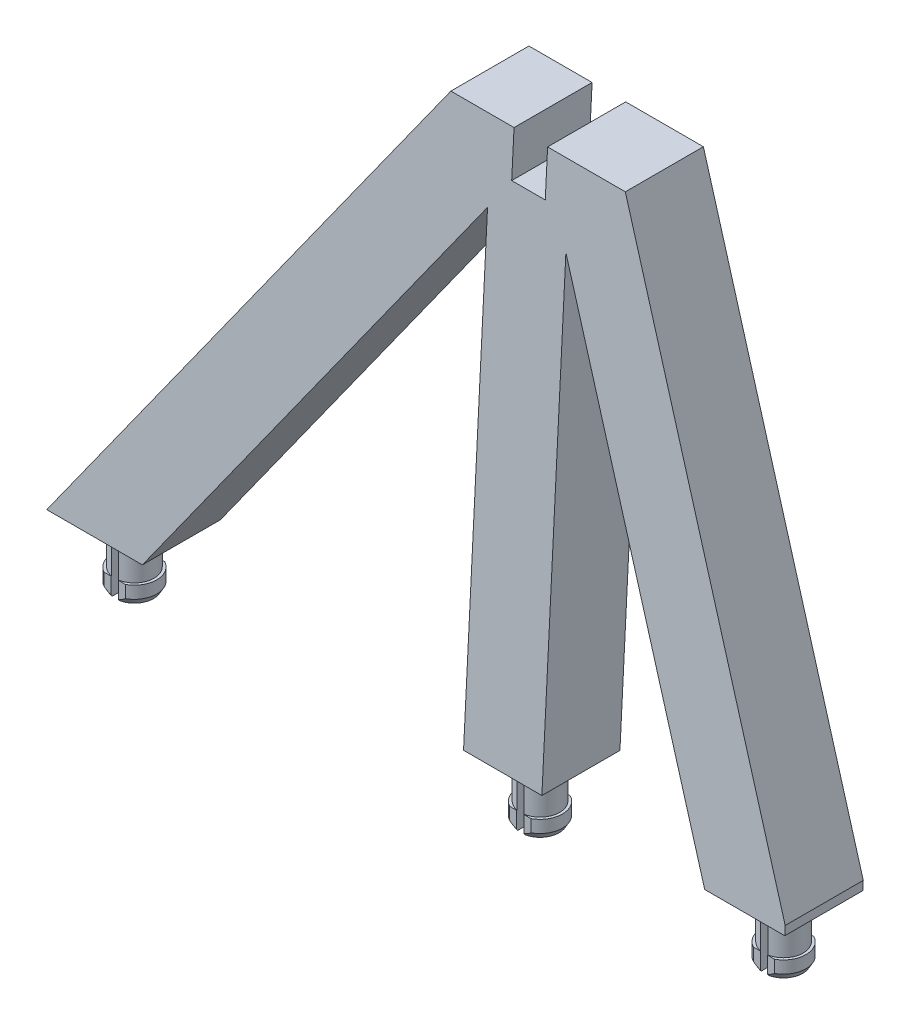
from build123d import *
from OCP.BRepFilletAPI import BRepFilletAPI_MakeChamfer

# Parameters (mm, degrees)
BOSS_EXTRUDE2_DEPTH     = 11.0744
CUT_EXTRUDE1_DEPTH      = 158.120213562
CUT_EXTRUDE1_DEPTH_BACK = 158.120213562
SKETCH3_W               = 4.7625
SKETCH3_H               = 6.35
CUT_EXTRUDE6_DEPTH      = 158.120213562
CUT_EXTRUDE6_DEPTH_BACK = 158.120213562
SKETCH12_W              = 1.27
SKETCH12_H              = 1.27
SKETCH12_W_2            = 12.7
SKETCH12_H_2            = 12.7
SKETCH13_R              = 2.794
BOSS_EXTRUDE3_DEPTH     = 6.35
SKETCH14_R              = 3.175
BOSS_EXTRUDE4_DEPTH     = 2.54
CUT_EXTRUDE7_REACH      = 163.613
SKETCH15_W              = 1.016
SKETCH15_H              = 6.35
SKETCH15_W_2            = 3.01608289
SKETCH15_H_2            = 0.381
SKETCH17_R              = 3.96875
BOSS_EXTRUDE5_DEPTH     = 16.44396
SKETCH18_R              = 2.38125
CUT_EXTRUDE9_DEPTH      = 5.334
CHAMFER1_SIZE           = 0.79375
CHAMFER1_SIZE2          = 0.458271776
SKETCH19_W              = 6.0325
SKETCH19_H              = 64.754314085
BOSS_EXTRUDE11_DEPTH    = 8.542621607


with BuildPart() as part:
    # Sketch2 → Boss-Extrude2 (new, along a direction that is not the sketch's normal)
    with BuildSketch(Plane(origin=(0, -0.301230094, -5.747812595), x_dir=(1, 0, 0), z_dir=(0, 0.05233595624294042, 0.998629534754574))):
        Polygon((-31.991936044, 0.301643486), (-59.03245329, 76.501643486), (-83.778875482, 76.501643486), (-137.117219796, 0.301643486), (-123.552823331, 0.301643486), (-77.992987563, 65.389143486), (-77.992987563, 0.301643486), (-66.880487563, 0.301643486), (-66.880487563, 65.389143486), (-43.783379083, 0.301643486), align=None)
    extrude(amount=BOSS_EXTRUDE2_DEPTH, dir=(0, 0, 1))

    # Sketch3 → Cut-Extrude1 (cut, two sides: drawn at the far end of the back side and taken through both)
    with BuildSketch(Plane.XY.offset(-CUT_EXTRUDE1_DEPTH_BACK)):
        with Locations((-72.436737563, 72.920570548)):
            Rectangle(SKETCH3_W, SKETCH3_H)
    extrude(amount=CUT_EXTRUDE1_DEPTH + CUT_EXTRUDE1_DEPTH_BACK, mode=Mode.SUBTRACT)

    # Sketch12 → Cut-Extrude6 (cut, two sides: drawn at the far end of the back side and taken through both)
    with BuildSketch(Plane.XY.offset(-CUT_EXTRUDE6_DEPTH_BACK)):
        with Locations((-31.794579083, 0.635)):
            Rectangle(SKETCH12_W, SKETCH12_H)
        with Locations((-144.340183331, 6.35)):
            Rectangle(SKETCH12_W_2, SKETCH12_H_2)
    extrude(amount=CUT_EXTRUDE6_DEPTH + CUT_EXTRUDE6_DEPTH_BACK, mode=Mode.SUBTRACT)

    # Shell13: read off the stored shape, not the designer's step
    # Shell13: loft between two sections, ruled curve by curve
    shell13_from = [
        Edge.make_line((-67.225707879, 73.555570548, -9.618483502), (-41.990365712, 2.54, -5.896715155)),
        Edge.make_line((-35.590124494, 2.54, -5.896715155), (-60.82546666, 73.555570548, -9.618483502)),
        Edge.make_line((-41.990365712, 2.54, -5.896715155), (-35.590124494, 2.54, -5.896715155)),
        Edge.make_line((-60.82546666, 73.555570548, -9.618483502), (-67.225707879, 73.555570548, -9.618483502)),
    ]
    shell13_to = [
        Edge.make_line((-67.225707879, 73.555570548, -1.087569261), (-41.990365712, 2.54, 2.634199086)),
        Edge.make_line((-35.590124494, 2.54, 2.634199086), (-60.82546666, 73.555570548, -1.087569261)),
        Edge.make_line((-41.990365712, 2.54, 2.634199086), (-35.590124494, 2.54, 2.634199086)),
        Edge.make_line((-60.82546666, 73.555570548, -1.087569261), (-67.225707879, 73.555570548, -1.087569261)),
    ]
    shell13 = Solid(Shell([*[Face.make_surface_from_curves(shell13_from[k], shell13_to[k]) for k in range(4)], Face(Wire(shell13_from)), Face(Wire(shell13_to))]))
    add(shell13, mode=Mode.SUBTRACT)

    # Shell13 2: loft between two sections, ruled curve by curve
    shell13_2_from = [
        Edge.make_line((-75.452987563, 2.54, -5.896715155), (-69.420487563, 2.54, -5.896715155)),
        Edge.make_line((-75.452987563, 67.205570548, -9.285694103), (-69.420487563, 67.205570548, -9.285694103)),
        Edge.make_line((-69.420487563, 2.54, -5.896715155), (-69.420487563, 67.205570548, -9.285694103)),
        Edge.make_line((-75.452987563, 67.205570548, -9.285694103), (-75.452987563, 2.54, -5.896715155)),
    ]
    shell13_2_to = [
        Edge.make_line((-75.452987563, 2.54, 2.634199086), (-69.420487563, 2.54, 2.634199086)),
        Edge.make_line((-75.452987563, 67.205570548, -0.754779862), (-69.420487563, 67.205570548, -0.754779862)),
        Edge.make_line((-69.420487563, 2.54, 2.634199086), (-69.420487563, 67.205570548, -0.754779862)),
        Edge.make_line((-75.452987563, 67.205570548, -0.754779862), (-75.452987563, 2.54, 2.634199086)),
    ]
    shell13_2 = Solid(Shell([*[Face.make_surface_from_curves(shell13_2_from[k], shell13_2_to[k]) for k in range(4)], Face(Wire(shell13_2_from)), Face(Wire(shell13_2_to))]))
    add(shell13_2, mode=Mode.SUBTRACT)

    # Shell13 3: loft between two sections, ruled curve by curve
    shell13_3_from = [
        Edge.make_line((-132.235001715, 2.54, -5.896715155), (-124.87427188, 2.54, -5.896715155)),
        Edge.make_line((-82.457426933, 73.555570548, -9.618483502), (-77.357987563, 73.555570548, -9.618483502)),
        Edge.make_line((-82.457426933, 73.555570548, -9.618483502), (-132.235001715, 2.54, -5.896715155)),
        Edge.make_line((-124.87427188, 2.54, -5.896715155), (-77.357987563, 70.329482632, -9.449411398)),
        Edge.make_line((-77.357987563, 70.329482632, -9.449411398), (-77.357987563, 73.555570548, -9.618483502)),
    ]
    shell13_3_to = [
        Edge.make_line((-132.235001715, 2.54, 2.634199086), (-124.87427188, 2.54, 2.634199086)),
        Edge.make_line((-82.457426933, 73.555570548, -1.087569261), (-77.357987563, 73.555570548, -1.087569261)),
        Edge.make_line((-82.457426933, 73.555570548, -1.087569261), (-132.235001715, 2.54, 2.634199086)),
        Edge.make_line((-124.87427188, 2.54, 2.634199086), (-77.357987563, 70.329482632, -0.918497157)),
        Edge.make_line((-77.357987563, 70.329482632, -0.918497157), (-77.357987563, 73.555570548, -1.087569261)),
    ]
    shell13_3 = Solid(Shell([*[Face.make_surface_from_curves(shell13_3_from[k], shell13_3_to[k]) for k in range(5)], Face(Wire(shell13_3_from)), Face(Wire(shell13_3_to))]))
    add(shell13_3, mode=Mode.SUBTRACT)

    # Sketch13 → Boss-Extrude3 (add)
    with BuildSketch(Plane.XZ):
        with Locations(Location((-130.216039796, -0.226399396, 0), (0, 0, 180))):
            Circle(SKETCH13_R)
        with Locations(Location((-72.680959083, -0.226399396, 0), (0, 0, 90))):
            Circle(SKETCH13_R)
        with Locations(Location((-38.131879083, -0.226399396, 0), (0, 0, 180))):
            Circle(SKETCH13_R)
    extrude(amount=BOSS_EXTRUDE3_DEPTH)

    # Sketch14 → Boss-Extrude4 (add)
    with BuildSketch(Plane.XZ.offset(6.35)):
        with Locations((-130.216039796, -0.226399396)):
            Circle(SKETCH14_R)
        with Locations((-72.680959083, -0.226399396)):
            Circle(SKETCH14_R)
        with Locations((-38.131879083, -0.226399396)):
            Circle(SKETCH14_R)
    extrude(amount=BOSS_EXTRUDE4_DEPTH)

    # Cut-Extrude7: up to this face of the body (flat: up to its plane)
    cut_extrude7_end = Plane(part.part.faces().sort_by_distance((-136.942109777, 0, -0.226399396))[0])
    # Sketch15 → Cut-Extrude7 (cut, up to the picked face)
    with BuildSketch(Plane.XZ.offset(8.89), mode=Mode.PRIVATE) as cut_extrude7_sk1:
        with Locations((-130.216039796, -0.226399396)):
            Rectangle(SKETCH15_W, SKETCH15_H)
    cut_extrude7_tool1 = split(extrude(cut_extrude7_sk1.sketch, amount=-CUT_EXTRUDE7_REACH, mode=Mode.PRIVATE), bisect_by=cut_extrude7_end, keep=Keep.BOTH, mode=Mode.PRIVATE)
    # Sketch15 → Cut-Extrude7 (cut, up to the picked face)
    with BuildSketch(Plane.XZ.offset(8.89), mode=Mode.PRIVATE) as cut_extrude7_sk2:
        with Locations((-72.680959083, -0.226399396)):
            Rectangle(SKETCH15_W, SKETCH15_H)
    cut_extrude7_tool2 = split(extrude(cut_extrude7_sk2.sketch, amount=-CUT_EXTRUDE7_REACH, mode=Mode.PRIVATE), bisect_by=cut_extrude7_end, keep=Keep.BOTH, mode=Mode.PRIVATE)
    # Sketch15 → Cut-Extrude7 (cut, up to the picked face)
    with BuildSketch(Plane.XZ.offset(8.89), mode=Mode.PRIVATE) as cut_extrude7_sk3:
        with Locations((-38.131879083, -0.226399396)):
            Rectangle(SKETCH15_W, SKETCH15_H)
    cut_extrude7_tool3 = split(extrude(cut_extrude7_sk3.sketch, amount=-CUT_EXTRUDE7_REACH, mode=Mode.PRIVATE), bisect_by=cut_extrude7_end, keep=Keep.BOTH, mode=Mode.PRIVATE)
    # Sketch15 → Cut-Extrude7 (cut, up to the picked face)
    with BuildSketch(Plane.XZ.offset(8.89), mode=Mode.PRIVATE) as cut_extrude7_sk4:
        with Locations((-130.216039796, 2.758100604)):
            Rectangle(SKETCH15_W_2, SKETCH15_H_2)
    cut_extrude7_tool4 = split(extrude(cut_extrude7_sk4.sketch, amount=-CUT_EXTRUDE7_REACH, mode=Mode.PRIVATE), bisect_by=cut_extrude7_end, keep=Keep.BOTH, mode=Mode.PRIVATE)
    # Sketch15 → Cut-Extrude7 (cut, up to the picked face)
    with BuildSketch(Plane.XZ.offset(8.89), mode=Mode.PRIVATE) as cut_extrude7_sk5:
        with Locations((-130.216039796, -3.210899396)):
            Rectangle(SKETCH15_W_2, SKETCH15_H_2)
    cut_extrude7_tool5 = split(extrude(cut_extrude7_sk5.sketch, amount=-CUT_EXTRUDE7_REACH, mode=Mode.PRIVATE), bisect_by=cut_extrude7_end, keep=Keep.BOTH, mode=Mode.PRIVATE)
    # Sketch15 → Cut-Extrude7 (cut, up to the picked face)
    with BuildSketch(Plane.XZ.offset(8.89), mode=Mode.PRIVATE) as cut_extrude7_sk6:
        with Locations((-72.680959083, 2.758100604)):
            Rectangle(SKETCH15_W_2, SKETCH15_H_2)
    cut_extrude7_tool6 = split(extrude(cut_extrude7_sk6.sketch, amount=-CUT_EXTRUDE7_REACH, mode=Mode.PRIVATE), bisect_by=cut_extrude7_end, keep=Keep.BOTH, mode=Mode.PRIVATE)
    # Sketch15 → Cut-Extrude7 (cut, up to the picked face)
    with BuildSketch(Plane.XZ.offset(8.89), mode=Mode.PRIVATE) as cut_extrude7_sk7:
        with Locations((-72.680959083, -3.210899396)):
            Rectangle(SKETCH15_W_2, SKETCH15_H_2)
    cut_extrude7_tool7 = split(extrude(cut_extrude7_sk7.sketch, amount=-CUT_EXTRUDE7_REACH, mode=Mode.PRIVATE), bisect_by=cut_extrude7_end, keep=Keep.BOTH, mode=Mode.PRIVATE)
    # Sketch15 → Cut-Extrude7 (cut, up to the picked face)
    with BuildSketch(Plane.XZ.offset(8.89), mode=Mode.PRIVATE) as cut_extrude7_sk8:
        with Locations((-38.131879083, -3.210899396)):
            Rectangle(SKETCH15_W_2, SKETCH15_H_2)
    cut_extrude7_tool8 = split(extrude(cut_extrude7_sk8.sketch, amount=-CUT_EXTRUDE7_REACH, mode=Mode.PRIVATE), bisect_by=cut_extrude7_end, keep=Keep.BOTH, mode=Mode.PRIVATE)
    # Sketch15 → Cut-Extrude7 (cut, up to the picked face)
    with BuildSketch(Plane.XZ.offset(8.89), mode=Mode.PRIVATE) as cut_extrude7_sk9:
        with Locations((-38.131879083, 2.758100604)):
            Rectangle(SKETCH15_W_2, SKETCH15_H_2)
    cut_extrude7_tool9 = split(extrude(cut_extrude7_sk9.sketch, amount=-CUT_EXTRUDE7_REACH, mode=Mode.PRIVATE), bisect_by=cut_extrude7_end, keep=Keep.BOTH, mode=Mode.PRIVATE)
    add(cut_extrude7_tool1.solids().sort_by(Axis((-130.21604, -8.89, -0.226399), (0, 1, 0)))[0], mode=Mode.SUBTRACT)
    add(cut_extrude7_tool2.solids().sort_by(Axis((-72.680959, -8.89, -0.226399), (0, 1, 0)))[0], mode=Mode.SUBTRACT)
    add(cut_extrude7_tool3.solids().sort_by(Axis((-38.131879, -8.89, -0.226399), (0, 1, 0)))[0], mode=Mode.SUBTRACT)
    add(cut_extrude7_tool4.solids().sort_by(Axis((-130.21604, -8.89, 2.758101), (0, 1, 0)))[0], mode=Mode.SUBTRACT)
    add(cut_extrude7_tool5.solids().sort_by(Axis((-130.21604, -8.89, -3.210899), (0, 1, 0)))[0], mode=Mode.SUBTRACT)
    add(cut_extrude7_tool6.solids().sort_by(Axis((-72.680959, -8.89, 2.758101), (0, 1, 0)))[0], mode=Mode.SUBTRACT)
    add(cut_extrude7_tool7.solids().sort_by(Axis((-72.680959, -8.89, -3.210899), (0, 1, 0)))[0], mode=Mode.SUBTRACT)
    add(cut_extrude7_tool8.solids().sort_by(Axis((-38.131879, -8.89, -3.210899), (0, 1, 0)))[0], mode=Mode.SUBTRACT)
    add(cut_extrude7_tool9.solids().sort_by(Axis((-38.131879, -8.89, 2.758101), (0, 1, 0)))[0], mode=Mode.SUBTRACT)

    # Sketch17 → Boss-Extrude5 (add, along a direction that is not the sketch's normal)
    with BuildSketch(Plane(origin=(0, 0.144631584, 2.759735025), x_dir=(-1, 0, 0), z_dir=(0, -0.052335956242940435, -0.998629534754574))):
        with Locations((72.436737563, 55.628895348)):
            Circle(SKETCH17_R)
    extrude(amount=BOSS_EXTRUDE5_DEPTH, dir=(0, 0, -1))

    # Sketch18 → Cut-Extrude9 (cut, symmetric)
    with BuildSketch(Plane(origin=(0, 56.273410548, 0), x_dir=(1, 0, 0), z_dir=(0, 1, 0))):
        with Locations((-69.801487563, 12.404616407)):
            Circle(SKETCH18_R)
    extrude(amount=CUT_EXTRUDE9_DEPTH, both=True, mode=Mode.SUBTRACT)

    # Chamfer1: one chamfer whose edges measure the first distance from different faces: ONE call of the kernel's chamfer builder (chamfer() names one face for all edges)
    chamfer1_edges_1 = [part.edges().sort_by_distance(p)[0] for p in [
        (-133.391039796, -8.89, -0.226399396),
    ]]
    chamfer1_side_1 = [part.faces().sort_by_distance(p)[0] for p in [
        (-133.391039796, -7.62, -0.226399396),
    ]]
    chamfer1_edges_2 = [part.edges().sort_by_distance(p)[0] for p in [
        (-127.041039796, -8.89, -0.226399396),
    ]]
    chamfer1_side_2 = [part.faces().sort_by_distance(p)[0] for p in [
        (-127.041039796, -7.62, -0.226399396),
    ]]
    chamfer1_edges_3 = [part.edges().sort_by_distance(p)[0] for p in [
        (-75.855959083, -8.89, -0.226399396),
    ]]
    chamfer1_side_3 = [part.faces().sort_by_distance(p)[0] for p in [
        (-75.855959083, -7.62, -0.226399396),
    ]]
    chamfer1_edges_4 = [part.edges().sort_by_distance(p)[0] for p in [
        (-69.505959083, -8.89, -0.226399396),
    ]]
    chamfer1_side_4 = [part.faces().sort_by_distance(p)[0] for p in [
        (-69.505959083, -7.62, -0.226399396),
    ]]
    chamfer1_edges_5 = [part.edges().sort_by_distance(p)[0] for p in [
        (-41.306879083, -8.89, -0.226399396),
    ]]
    chamfer1_side_5 = [part.faces().sort_by_distance(p)[0] for p in [
        (-41.306879083, -7.62, -0.226399396),
    ]]
    chamfer1_edges_6 = [part.edges().sort_by_distance(p)[0] for p in [
        (-34.956879083, -8.89, -0.226399396),
    ]]
    chamfer1_side_6 = [part.faces().sort_by_distance(p)[0] for p in [
        (-34.956879083, -7.62, -0.226399396),
    ]]
    chamfer1 = BRepFilletAPI_MakeChamfer(part.part.solid().wrapped)
    for e in chamfer1_edges_1:
        chamfer1.Add(CHAMFER1_SIZE, CHAMFER1_SIZE2, e.wrapped, chamfer1_side_1[0].wrapped)  # the first distance lies on this face
    for e in chamfer1_edges_2:
        chamfer1.Add(CHAMFER1_SIZE, CHAMFER1_SIZE2, e.wrapped, chamfer1_side_2[0].wrapped)  # the first distance lies on this face
    for e in chamfer1_edges_3:
        chamfer1.Add(CHAMFER1_SIZE, CHAMFER1_SIZE2, e.wrapped, chamfer1_side_3[0].wrapped)  # the first distance lies on this face
    for e in chamfer1_edges_4:
        chamfer1.Add(CHAMFER1_SIZE, CHAMFER1_SIZE2, e.wrapped, chamfer1_side_4[0].wrapped)  # the first distance lies on this face
    for e in chamfer1_edges_5:
        chamfer1.Add(CHAMFER1_SIZE, CHAMFER1_SIZE2, e.wrapped, chamfer1_side_5[0].wrapped)  # the first distance lies on this face
    for e in chamfer1_edges_6:
        chamfer1.Add(CHAMFER1_SIZE, CHAMFER1_SIZE2, e.wrapped, chamfer1_side_6[0].wrapped)  # the first distance lies on this face
    add(Compound.cast(chamfer1.Shape()), mode=Mode.REPLACE)

    # Sketch19 → Boss-Extrude11 (add, along a direction that is not the sketch's normal)
    with BuildSketch(Plane(origin=(0, -0.301230094, -5.747812595), x_dir=(-1, 0, 0), z_dir=(0, -0.052335956242940455, -0.9986295347545742))):
        with Locations((72.436737563, 35.222286287)):
            Rectangle(SKETCH19_W, SKETCH19_H)
        Polygon((77.357987563, 73.958157727), (77.357987563, 70.727642501), (124.87427188, 2.845129245), (132.235001715, 2.845129245), (82.457426933, 73.958157727), align=None)
        Polygon((67.225707879, 73.958157727), (41.990365712, 2.845129245), (35.590124494, 2.845129245), (60.82546666, 73.958157727), align=None)
    extrude(amount=-BOSS_EXTRUDE11_DEPTH, dir=(0, 0, -1))


solid = part.part
